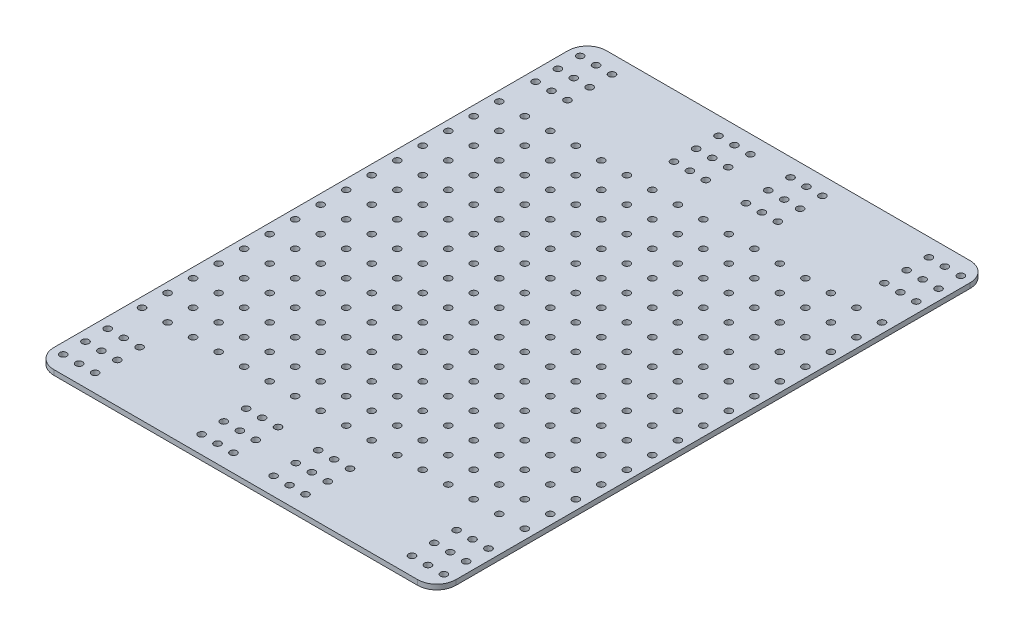
from build123d import *

# Parameters (mm, degrees)
SKETCH2_W            = 200.117666866
SKETCH2_H            = 275
BOSS_EXTRUDE1_DEPTH  = 2.5
M3_CLEARANCE_HOLE1_D = 3.4
MIRROR2_COPY_1_D     = 3.4
FILLET1_R            = 9.525
M3_CLEARANCE_HOLE2_D = 3.4
LPATTERN1_COUNT      = 8
LPATTERN1_PITCH      = 12.7
LPATTERN1_COUNT_DIR2 = 8
LPATTERN1_PITCH_DIR2 = 12.7
MIRROR3_COPY_1_D     = 3.4
MIRROR3_COPY_2_D     = 3.4
MIRROR3_COPY_3_D     = 3.4
MIRROR3_COPY_4_D     = 3.4
MIRROR3_COPY_5_D     = 3.4
MIRROR3_COPY_6_D     = 3.4
MIRROR3_COPY_7_D     = 3.4
MIRROR3_COPY_8_D     = 3.4
MIRROR3_COPY_9_D     = 3.4
MIRROR3_COPY_10_D    = 3.4
MIRROR3_COPY_11_D    = 3.4
MIRROR3_COPY_12_D    = 3.4
MIRROR3_COPY_13_D    = 3.4
MIRROR3_COPY_14_D    = 3.4
MIRROR3_COPY_15_D    = 3.4
MIRROR3_COPY_16_D    = 3.4
MIRROR3_COPY_17_D    = 3.4
MIRROR3_COPY_18_D    = 3.4
MIRROR3_COPY_19_D    = 3.4
MIRROR3_COPY_20_D    = 3.4
MIRROR3_COPY_21_D    = 3.4
MIRROR3_COPY_22_D    = 3.4
MIRROR3_COPY_23_D    = 3.4
MIRROR3_COPY_24_D    = 3.4
MIRROR3_COPY_25_D    = 3.4
MIRROR3_COPY_26_D    = 3.4
MIRROR3_COPY_27_D    = 3.4
MIRROR3_COPY_28_D    = 3.4
MIRROR3_COPY_29_D    = 3.4
MIRROR3_COPY_30_D    = 3.4
MIRROR3_COPY_31_D    = 3.4
MIRROR3_COPY_32_D    = 3.4
MIRROR3_COPY_33_D    = 3.4
MIRROR3_COPY_34_D    = 3.4
MIRROR3_COPY_35_D    = 3.4
MIRROR3_COPY_36_D    = 3.4
MIRROR3_COPY_37_D    = 3.4
MIRROR3_COPY_38_D    = 3.4
MIRROR3_COPY_39_D    = 3.4
MIRROR3_COPY_40_D    = 3.4
MIRROR3_COPY_41_D    = 3.4
MIRROR3_COPY_42_D    = 3.4
MIRROR3_COPY_43_D    = 3.4
MIRROR3_COPY_44_D    = 3.4
MIRROR3_COPY_45_D    = 3.4
MIRROR3_COPY_46_D    = 3.4
MIRROR3_COPY_47_D    = 3.4
MIRROR3_COPY_48_D    = 3.4
MIRROR3_COPY_49_D    = 3.4
MIRROR3_COPY_50_D    = 3.4
MIRROR3_COPY_51_D    = 3.4
MIRROR3_COPY_52_D    = 3.4
MIRROR3_COPY_53_D    = 3.4
MIRROR3_COPY_54_D    = 3.4
MIRROR3_COPY_55_D    = 3.4
MIRROR3_COPY_56_D    = 3.4
MIRROR3_COPY_57_D    = 3.4
MIRROR3_COPY_58_D    = 3.4
MIRROR3_COPY_59_D    = 3.4
MIRROR3_COPY_60_D    = 3.4
MIRROR3_COPY_61_D    = 3.4
MIRROR3_COPY_62_D    = 3.4
MIRROR3_COPY_63_D    = 3.4
MIRROR4_COPY_1_D     = 3.4
MIRROR4_COPY_2_D     = 3.4
MIRROR4_COPY_3_D     = 3.4
MIRROR4_COPY_4_D     = 3.4
MIRROR4_COPY_5_D     = 3.4
MIRROR4_COPY_6_D     = 3.4
MIRROR4_COPY_7_D     = 3.4
MIRROR4_COPY_8_D     = 3.4
MIRROR4_COPY_9_D     = 3.4
MIRROR4_COPY_10_D    = 3.4
MIRROR4_COPY_11_D    = 3.4
MIRROR4_COPY_12_D    = 3.4
MIRROR4_COPY_13_D    = 3.4
MIRROR4_COPY_14_D    = 3.4
MIRROR4_COPY_15_D    = 3.4
MIRROR4_COPY_16_D    = 3.4
MIRROR4_COPY_17_D    = 3.4
MIRROR4_COPY_18_D    = 3.4
MIRROR4_COPY_19_D    = 3.4
MIRROR4_COPY_20_D    = 3.4
MIRROR4_COPY_21_D    = 3.4
MIRROR4_COPY_22_D    = 3.4
MIRROR4_COPY_23_D    = 3.4
MIRROR4_COPY_24_D    = 3.4
MIRROR4_COPY_25_D    = 3.4
MIRROR4_COPY_26_D    = 3.4
MIRROR4_COPY_27_D    = 3.4
MIRROR4_COPY_28_D    = 3.4
MIRROR4_COPY_29_D    = 3.4
MIRROR4_COPY_30_D    = 3.4
MIRROR4_COPY_31_D    = 3.4
MIRROR4_COPY_32_D    = 3.4
MIRROR4_COPY_33_D    = 3.4
MIRROR4_COPY_34_D    = 3.4
MIRROR4_COPY_35_D    = 3.4
MIRROR4_COPY_36_D    = 3.4
MIRROR4_COPY_37_D    = 3.4
MIRROR4_COPY_38_D    = 3.4
MIRROR4_COPY_39_D    = 3.4
MIRROR4_COPY_40_D    = 3.4
MIRROR4_COPY_41_D    = 3.4
MIRROR4_COPY_42_D    = 3.4
MIRROR4_COPY_43_D    = 3.4
MIRROR4_COPY_44_D    = 3.4
MIRROR4_COPY_45_D    = 3.4
MIRROR4_COPY_46_D    = 3.4
MIRROR4_COPY_47_D    = 3.4
MIRROR4_COPY_48_D    = 3.4
MIRROR4_COPY_49_D    = 3.4
MIRROR4_COPY_50_D    = 3.4
MIRROR4_COPY_51_D    = 3.4
MIRROR4_COPY_52_D    = 3.4
MIRROR4_COPY_53_D    = 3.4
MIRROR4_COPY_54_D    = 3.4
MIRROR4_COPY_55_D    = 3.4
MIRROR4_COPY_56_D    = 3.4
MIRROR4_COPY_57_D    = 3.4
MIRROR4_COPY_58_D    = 3.4
MIRROR4_COPY_59_D    = 3.4
MIRROR4_COPY_60_D    = 3.4
MIRROR4_COPY_61_D    = 3.4
MIRROR4_COPY_62_D    = 3.4
MIRROR4_COPY_63_D    = 3.4
MIRROR4_COPY_64_D    = 3.4
MIRROR4_COPY_65_D    = 3.4
MIRROR4_COPY_66_D    = 3.4
MIRROR4_COPY_67_D    = 3.4
MIRROR4_COPY_68_D    = 3.4
MIRROR4_COPY_69_D    = 3.4
MIRROR4_COPY_70_D    = 3.4
MIRROR4_COPY_71_D    = 3.4
MIRROR4_COPY_72_D    = 3.4
MIRROR4_COPY_73_D    = 3.4
MIRROR4_COPY_74_D    = 3.4
MIRROR4_COPY_75_D    = 3.4
MIRROR4_COPY_76_D    = 3.4
MIRROR4_COPY_77_D    = 3.4
MIRROR4_COPY_78_D    = 3.4
MIRROR4_COPY_79_D    = 3.4
MIRROR4_COPY_80_D    = 3.4
MIRROR4_COPY_81_D    = 3.4
MIRROR4_COPY_82_D    = 3.4
MIRROR4_COPY_83_D    = 3.4
MIRROR4_COPY_84_D    = 3.4
MIRROR4_COPY_85_D    = 3.4
MIRROR4_COPY_86_D    = 3.4
MIRROR4_COPY_87_D    = 3.4
MIRROR4_COPY_88_D    = 3.4
MIRROR4_COPY_89_D    = 3.4
MIRROR4_COPY_90_D    = 3.4
MIRROR4_COPY_91_D    = 3.4
MIRROR4_COPY_92_D    = 3.4
MIRROR4_COPY_93_D    = 3.4
MIRROR4_COPY_94_D    = 3.4
MIRROR4_COPY_95_D    = 3.4
MIRROR4_COPY_96_D    = 3.4
MIRROR4_COPY_97_D    = 3.4
MIRROR4_COPY_98_D    = 3.4
MIRROR4_COPY_99_D    = 3.4
MIRROR4_COPY_100_D   = 3.4
MIRROR4_COPY_101_D   = 3.4
MIRROR4_COPY_102_D   = 3.4
MIRROR4_COPY_103_D   = 3.4
MIRROR4_COPY_104_D   = 3.4
MIRROR4_COPY_105_D   = 3.4
MIRROR4_COPY_106_D   = 3.4
MIRROR4_COPY_107_D   = 3.4
MIRROR4_COPY_108_D   = 3.4
MIRROR4_COPY_109_D   = 3.4
MIRROR4_COPY_110_D   = 3.4
MIRROR4_COPY_111_D   = 3.4
MIRROR4_COPY_112_D   = 3.4
MIRROR4_COPY_113_D   = 3.4
MIRROR4_COPY_114_D   = 3.4
MIRROR4_COPY_115_D   = 3.4
MIRROR4_COPY_116_D   = 3.4
MIRROR4_COPY_117_D   = 3.4
MIRROR4_COPY_118_D   = 3.4
MIRROR4_COPY_119_D   = 3.4
MIRROR4_COPY_120_D   = 3.4
MIRROR4_COPY_121_D   = 3.4
MIRROR4_COPY_122_D   = 3.4
MIRROR4_COPY_123_D   = 3.4
MIRROR4_COPY_124_D   = 3.4
MIRROR4_COPY_125_D   = 3.4
MIRROR4_COPY_126_D   = 3.4
MIRROR4_COPY_127_D   = 3.4


with BuildPart() as part:
    # Sketch2 → Boss-Extrude1 (new body)
    with BuildSketch(Plane(origin=(0, 50, 0), x_dir=(1, 0, 0), z_dir=(0, 1, 0))):
        Rectangle(SKETCH2_W, SKETCH2_H)
    extrude(amount=BOSS_EXTRUDE1_DEPTH)

    # M3 Clearance Hole1 (through all)
    with Locations(Plane(origin=(-94.749736615, 52.5, 106.4725), x_dir=(1, 0, 0), z_dir=(0, 1, 0))):
        with Locations((0, 0), (7.9375, 0), (15.875, 0), (15.875, -11.08875), (7.9375, -11.08875), (0, -11.08875), (0, -22.1775), (7.9375, -22.1775), (15.875, -22.1775), (68.893486615, 0), (76.830986615, 0), (84.768486615, 0), (84.768486615, -11.08875), (76.830986615, -11.08875), (68.893486615, -11.08875), (68.893486615, -22.1775), (76.830986615, -22.1775), (84.768486615, -22.1775)):
            m3_clearance_hole1 = Hole(M3_CLEARANCE_HOLE1_D / 2)

    # Mirror1: M3 Clearance Hole1 across plane
    add(m3_clearance_hole1.mirror(Plane(origin=(0, 0, 0), x_dir=(0, 0, 1), z_dir=(1, 0, 0))), mode=Mode.SUBTRACT)

    # Mirror2: M3 Clearance Hole1 across plane
    add(m3_clearance_hole1.mirror(Plane.XY), mode=Mode.SUBTRACT)

    # Mirror2 copy 1 (through all)
    with Locations(Plane(origin=(94.749736615, 52.5, -106.4725), x_dir=(-1, 0, 0), z_dir=(0, 1, 0))):
        with Locations((0, 0), (7.9375, 0), (15.875, 0), (15.875, -11.08875), (7.9375, -11.08875), (0, -11.08875), (0, -22.1775), (7.9375, -22.1775), (15.875, -22.1775), (68.893486615, 0), (76.830986615, 0), (84.768486615, 0), (84.768486615, -11.08875), (76.830986615, -11.08875), (68.893486615, -11.08875), (68.893486615, -22.1775), (76.830986615, -22.1775), (84.768486615, -22.1775)):
            Hole(MIRROR2_COPY_1_D / 2)

    # Fillet1
    fillet1_edges = [part.edges().sort_by_distance(p)[0] for p in [
        (-100.058833433, 51.25, -137.5),
        (100.058833433, 51.25, 137.5),
        (-100.058833433, 51.25, 137.5),
        (100.058833433, 51.25, -137.5),
    ]]
    fillet(fillet1_edges, radius=FILLET1_R)

    # M3 Clearance Hole2 (through all)
    with Locations(Plane(origin=(0, 52.5, 0), x_dir=(1, 0, 0), z_dir=(0, 1, 0))):
        with Locations((6.35, 0)):
            m3_clearance_hole2 = Hole(M3_CLEARANCE_HOLE2_D / 2)

    # LPattern1: M3 Clearance Hole2 8 × 8
    with Locations(*[(j * LPATTERN1_PITCH_DIR2, 0, i * LPATTERN1_PITCH) for i in range(LPATTERN1_COUNT) for j in range(LPATTERN1_COUNT_DIR2) if (i, j) != (0, 0)]):
        add(m3_clearance_hole2, mode=Mode.SUBTRACT)

    # Mirror3: M3 Clearance Hole2 across plane
    add(m3_clearance_hole2.mirror(Plane.XY), mode=Mode.SUBTRACT)

    # Mirror3 copy 1 (through all)
    with Locations(Plane(origin=(12.7, 52.5, 0), x_dir=(1, 0, 0), z_dir=(0, 1, 0))):
        with Locations((6.35, 0)):
            Hole(MIRROR3_COPY_1_D / 2)

    # Mirror3 copy 2 (through all)
    with Locations(Plane(origin=(25.4, 52.5, 0), x_dir=(1, 0, 0), z_dir=(0, 1, 0))):
        with Locations((6.35, 0)):
            Hole(MIRROR3_COPY_2_D / 2)

    # Mirror3 copy 3 (through all)
    with Locations(Plane(origin=(38.1, 52.5, 0), x_dir=(1, 0, 0), z_dir=(0, 1, 0))):
        with Locations((6.35, 0)):
            Hole(MIRROR3_COPY_3_D / 2)

    # Mirror3 copy 4 (through all)
    with Locations(Plane(origin=(50.8, 52.5, 0), x_dir=(1, 0, 0), z_dir=(0, 1, 0))):
        with Locations((6.35, 0)):
            Hole(MIRROR3_COPY_4_D / 2)

    # Mirror3 copy 5 (through all)
    with Locations(Plane(origin=(63.5, 52.5, 0), x_dir=(1, 0, 0), z_dir=(0, 1, 0))):
        with Locations((6.35, 0)):
            Hole(MIRROR3_COPY_5_D / 2)

    # Mirror3 copy 6 (through all)
    with Locations(Plane(origin=(76.2, 52.5, 0), x_dir=(1, 0, 0), z_dir=(0, 1, 0))):
        with Locations((6.35, 0)):
            Hole(MIRROR3_COPY_6_D / 2)

    # Mirror3 copy 7 (through all)
    with Locations(Plane(origin=(88.9, 52.5, 0), x_dir=(1, 0, 0), z_dir=(0, 1, 0))):
        with Locations((6.35, 0)):
            Hole(MIRROR3_COPY_7_D / 2)

    # Mirror3 copy 8 (through all)
    with Locations(Plane(origin=(0, 52.5, -12.7), x_dir=(1, 0, 0), z_dir=(0, 1, 0))):
        with Locations((6.35, 0)):
            Hole(MIRROR3_COPY_8_D / 2)

    # Mirror3 copy 9 (through all)
    with Locations(Plane(origin=(12.7, 52.5, -12.7), x_dir=(1, 0, 0), z_dir=(0, 1, 0))):
        with Locations((6.35, 0)):
            Hole(MIRROR3_COPY_9_D / 2)

    # Mirror3 copy 10 (through all)
    with Locations(Plane(origin=(25.4, 52.5, -12.7), x_dir=(1, 0, 0), z_dir=(0, 1, 0))):
        with Locations((6.35, 0)):
            Hole(MIRROR3_COPY_10_D / 2)

    # Mirror3 copy 11 (through all)
    with Locations(Plane(origin=(38.1, 52.5, -12.7), x_dir=(1, 0, 0), z_dir=(0, 1, 0))):
        with Locations((6.35, 0)):
            Hole(MIRROR3_COPY_11_D / 2)

    # Mirror3 copy 12 (through all)
    with Locations(Plane(origin=(50.8, 52.5, -12.7), x_dir=(1, 0, 0), z_dir=(0, 1, 0))):
        with Locations((6.35, 0)):
            Hole(MIRROR3_COPY_12_D / 2)

    # Mirror3 copy 13 (through all)
    with Locations(Plane(origin=(63.5, 52.5, -12.7), x_dir=(1, 0, 0), z_dir=(0, 1, 0))):
        with Locations((6.35, 0)):
            Hole(MIRROR3_COPY_13_D / 2)

    # Mirror3 copy 14 (through all)
    with Locations(Plane(origin=(76.2, 52.5, -12.7), x_dir=(1, 0, 0), z_dir=(0, 1, 0))):
        with Locations((6.35, 0)):
            Hole(MIRROR3_COPY_14_D / 2)

    # Mirror3 copy 15 (through all)
    with Locations(Plane(origin=(88.9, 52.5, -12.7), x_dir=(1, 0, 0), z_dir=(0, 1, 0))):
        with Locations((6.35, 0)):
            Hole(MIRROR3_COPY_15_D / 2)

    # Mirror3 copy 16 (through all)
    with Locations(Plane(origin=(0, 52.5, -25.4), x_dir=(1, 0, 0), z_dir=(0, 1, 0))):
        with Locations((6.35, 0)):
            Hole(MIRROR3_COPY_16_D / 2)

    # Mirror3 copy 17 (through all)
    with Locations(Plane(origin=(12.7, 52.5, -25.4), x_dir=(1, 0, 0), z_dir=(0, 1, 0))):
        with Locations((6.35, 0)):
            Hole(MIRROR3_COPY_17_D / 2)

    # Mirror3 copy 18 (through all)
    with Locations(Plane(origin=(25.4, 52.5, -25.4), x_dir=(1, 0, 0), z_dir=(0, 1, 0))):
        with Locations((6.35, 0)):
            Hole(MIRROR3_COPY_18_D / 2)

    # Mirror3 copy 19 (through all)
    with Locations(Plane(origin=(38.1, 52.5, -25.4), x_dir=(1, 0, 0), z_dir=(0, 1, 0))):
        with Locations((6.35, 0)):
            Hole(MIRROR3_COPY_19_D / 2)

    # Mirror3 copy 20 (through all)
    with Locations(Plane(origin=(50.8, 52.5, -25.4), x_dir=(1, 0, 0), z_dir=(0, 1, 0))):
        with Locations((6.35, 0)):
            Hole(MIRROR3_COPY_20_D / 2)

    # Mirror3 copy 21 (through all)
    with Locations(Plane(origin=(63.5, 52.5, -25.4), x_dir=(1, 0, 0), z_dir=(0, 1, 0))):
        with Locations((6.35, 0)):
            Hole(MIRROR3_COPY_21_D / 2)

    # Mirror3 copy 22 (through all)
    with Locations(Plane(origin=(76.2, 52.5, -25.4), x_dir=(1, 0, 0), z_dir=(0, 1, 0))):
        with Locations((6.35, 0)):
            Hole(MIRROR3_COPY_22_D / 2)

    # Mirror3 copy 23 (through all)
    with Locations(Plane(origin=(88.9, 52.5, -25.4), x_dir=(1, 0, 0), z_dir=(0, 1, 0))):
        with Locations((6.35, 0)):
            Hole(MIRROR3_COPY_23_D / 2)

    # Mirror3 copy 24 (through all)
    with Locations(Plane(origin=(0, 52.5, -38.1), x_dir=(1, 0, 0), z_dir=(0, 1, 0))):
        with Locations((6.35, 0)):
            Hole(MIRROR3_COPY_24_D / 2)

    # Mirror3 copy 25 (through all)
    with Locations(Plane(origin=(12.7, 52.5, -38.1), x_dir=(1, 0, 0), z_dir=(0, 1, 0))):
        with Locations((6.35, 0)):
            Hole(MIRROR3_COPY_25_D / 2)

    # Mirror3 copy 26 (through all)
    with Locations(Plane(origin=(25.4, 52.5, -38.1), x_dir=(1, 0, 0), z_dir=(0, 1, 0))):
        with Locations((6.35, 0)):
            Hole(MIRROR3_COPY_26_D / 2)

    # Mirror3 copy 27 (through all)
    with Locations(Plane(origin=(38.1, 52.5, -38.1), x_dir=(1, 0, 0), z_dir=(0, 1, 0))):
        with Locations((6.35, 0)):
            Hole(MIRROR3_COPY_27_D / 2)

    # Mirror3 copy 28 (through all)
    with Locations(Plane(origin=(50.8, 52.5, -38.1), x_dir=(1, 0, 0), z_dir=(0, 1, 0))):
        with Locations((6.35, 0)):
            Hole(MIRROR3_COPY_28_D / 2)

    # Mirror3 copy 29 (through all)
    with Locations(Plane(origin=(63.5, 52.5, -38.1), x_dir=(1, 0, 0), z_dir=(0, 1, 0))):
        with Locations((6.35, 0)):
            Hole(MIRROR3_COPY_29_D / 2)

    # Mirror3 copy 30 (through all)
    with Locations(Plane(origin=(76.2, 52.5, -38.1), x_dir=(1, 0, 0), z_dir=(0, 1, 0))):
        with Locations((6.35, 0)):
            Hole(MIRROR3_COPY_30_D / 2)

    # Mirror3 copy 31 (through all)
    with Locations(Plane(origin=(88.9, 52.5, -38.1), x_dir=(1, 0, 0), z_dir=(0, 1, 0))):
        with Locations((6.35, 0)):
            Hole(MIRROR3_COPY_31_D / 2)

    # Mirror3 copy 32 (through all)
    with Locations(Plane(origin=(0, 52.5, -50.8), x_dir=(1, 0, 0), z_dir=(0, 1, 0))):
        with Locations((6.35, 0)):
            Hole(MIRROR3_COPY_32_D / 2)

    # Mirror3 copy 33 (through all)
    with Locations(Plane(origin=(12.7, 52.5, -50.8), x_dir=(1, 0, 0), z_dir=(0, 1, 0))):
        with Locations((6.35, 0)):
            Hole(MIRROR3_COPY_33_D / 2)

    # Mirror3 copy 34 (through all)
    with Locations(Plane(origin=(25.4, 52.5, -50.8), x_dir=(1, 0, 0), z_dir=(0, 1, 0))):
        with Locations((6.35, 0)):
            Hole(MIRROR3_COPY_34_D / 2)

    # Mirror3 copy 35 (through all)
    with Locations(Plane(origin=(38.1, 52.5, -50.8), x_dir=(1, 0, 0), z_dir=(0, 1, 0))):
        with Locations((6.35, 0)):
            Hole(MIRROR3_COPY_35_D / 2)

    # Mirror3 copy 36 (through all)
    with Locations(Plane(origin=(50.8, 52.5, -50.8), x_dir=(1, 0, 0), z_dir=(0, 1, 0))):
        with Locations((6.35, 0)):
            Hole(MIRROR3_COPY_36_D / 2)

    # Mirror3 copy 37 (through all)
    with Locations(Plane(origin=(63.5, 52.5, -50.8), x_dir=(1, 0, 0), z_dir=(0, 1, 0))):
        with Locations((6.35, 0)):
            Hole(MIRROR3_COPY_37_D / 2)

    # Mirror3 copy 38 (through all)
    with Locations(Plane(origin=(76.2, 52.5, -50.8), x_dir=(1, 0, 0), z_dir=(0, 1, 0))):
        with Locations((6.35, 0)):
            Hole(MIRROR3_COPY_38_D / 2)

    # Mirror3 copy 39 (through all)
    with Locations(Plane(origin=(88.9, 52.5, -50.8), x_dir=(1, 0, 0), z_dir=(0, 1, 0))):
        with Locations((6.35, 0)):
            Hole(MIRROR3_COPY_39_D / 2)

    # Mirror3 copy 40 (through all)
    with Locations(Plane(origin=(0, 52.5, -63.5), x_dir=(1, 0, 0), z_dir=(0, 1, 0))):
        with Locations((6.35, 0)):
            Hole(MIRROR3_COPY_40_D / 2)

    # Mirror3 copy 41 (through all)
    with Locations(Plane(origin=(12.7, 52.5, -63.5), x_dir=(1, 0, 0), z_dir=(0, 1, 0))):
        with Locations((6.35, 0)):
            Hole(MIRROR3_COPY_41_D / 2)

    # Mirror3 copy 42 (through all)
    with Locations(Plane(origin=(25.4, 52.5, -63.5), x_dir=(1, 0, 0), z_dir=(0, 1, 0))):
        with Locations((6.35, 0)):
            Hole(MIRROR3_COPY_42_D / 2)

    # Mirror3 copy 43 (through all)
    with Locations(Plane(origin=(38.1, 52.5, -63.5), x_dir=(1, 0, 0), z_dir=(0, 1, 0))):
        with Locations((6.35, 0)):
            Hole(MIRROR3_COPY_43_D / 2)

    # Mirror3 copy 44 (through all)
    with Locations(Plane(origin=(50.8, 52.5, -63.5), x_dir=(1, 0, 0), z_dir=(0, 1, 0))):
        with Locations((6.35, 0)):
            Hole(MIRROR3_COPY_44_D / 2)

    # Mirror3 copy 45 (through all)
    with Locations(Plane(origin=(63.5, 52.5, -63.5), x_dir=(1, 0, 0), z_dir=(0, 1, 0))):
        with Locations((6.35, 0)):
            Hole(MIRROR3_COPY_45_D / 2)

    # Mirror3 copy 46 (through all)
    with Locations(Plane(origin=(76.2, 52.5, -63.5), x_dir=(1, 0, 0), z_dir=(0, 1, 0))):
        with Locations((6.35, 0)):
            Hole(MIRROR3_COPY_46_D / 2)

    # Mirror3 copy 47 (through all)
    with Locations(Plane(origin=(88.9, 52.5, -63.5), x_dir=(1, 0, 0), z_dir=(0, 1, 0))):
        with Locations((6.35, 0)):
            Hole(MIRROR3_COPY_47_D / 2)

    # Mirror3 copy 48 (through all)
    with Locations(Plane(origin=(0, 52.5, -76.2), x_dir=(1, 0, 0), z_dir=(0, 1, 0))):
        with Locations((6.35, 0)):
            Hole(MIRROR3_COPY_48_D / 2)

    # Mirror3 copy 49 (through all)
    with Locations(Plane(origin=(12.7, 52.5, -76.2), x_dir=(1, 0, 0), z_dir=(0, 1, 0))):
        with Locations((6.35, 0)):
            Hole(MIRROR3_COPY_49_D / 2)

    # Mirror3 copy 50 (through all)
    with Locations(Plane(origin=(25.4, 52.5, -76.2), x_dir=(1, 0, 0), z_dir=(0, 1, 0))):
        with Locations((6.35, 0)):
            Hole(MIRROR3_COPY_50_D / 2)

    # Mirror3 copy 51 (through all)
    with Locations(Plane(origin=(38.1, 52.5, -76.2), x_dir=(1, 0, 0), z_dir=(0, 1, 0))):
        with Locations((6.35, 0)):
            Hole(MIRROR3_COPY_51_D / 2)

    # Mirror3 copy 52 (through all)
    with Locations(Plane(origin=(50.8, 52.5, -76.2), x_dir=(1, 0, 0), z_dir=(0, 1, 0))):
        with Locations((6.35, 0)):
            Hole(MIRROR3_COPY_52_D / 2)

    # Mirror3 copy 53 (through all)
    with Locations(Plane(origin=(63.5, 52.5, -76.2), x_dir=(1, 0, 0), z_dir=(0, 1, 0))):
        with Locations((6.35, 0)):
            Hole(MIRROR3_COPY_53_D / 2)

    # Mirror3 copy 54 (through all)
    with Locations(Plane(origin=(76.2, 52.5, -76.2), x_dir=(1, 0, 0), z_dir=(0, 1, 0))):
        with Locations((6.35, 0)):
            Hole(MIRROR3_COPY_54_D / 2)

    # Mirror3 copy 55 (through all)
    with Locations(Plane(origin=(88.9, 52.5, -76.2), x_dir=(1, 0, 0), z_dir=(0, 1, 0))):
        with Locations((6.35, 0)):
            Hole(MIRROR3_COPY_55_D / 2)

    # Mirror3 copy 56 (through all)
    with Locations(Plane(origin=(0, 52.5, -88.9), x_dir=(1, 0, 0), z_dir=(0, 1, 0))):
        with Locations((6.35, 0)):
            Hole(MIRROR3_COPY_56_D / 2)

    # Mirror3 copy 57 (through all)
    with Locations(Plane(origin=(12.7, 52.5, -88.9), x_dir=(1, 0, 0), z_dir=(0, 1, 0))):
        with Locations((6.35, 0)):
            Hole(MIRROR3_COPY_57_D / 2)

    # Mirror3 copy 58 (through all)
    with Locations(Plane(origin=(25.4, 52.5, -88.9), x_dir=(1, 0, 0), z_dir=(0, 1, 0))):
        with Locations((6.35, 0)):
            Hole(MIRROR3_COPY_58_D / 2)

    # Mirror3 copy 59 (through all)
    with Locations(Plane(origin=(38.1, 52.5, -88.9), x_dir=(1, 0, 0), z_dir=(0, 1, 0))):
        with Locations((6.35, 0)):
            Hole(MIRROR3_COPY_59_D / 2)

    # Mirror3 copy 60 (through all)
    with Locations(Plane(origin=(50.8, 52.5, -88.9), x_dir=(1, 0, 0), z_dir=(0, 1, 0))):
        with Locations((6.35, 0)):
            Hole(MIRROR3_COPY_60_D / 2)

    # Mirror3 copy 61 (through all)
    with Locations(Plane(origin=(63.5, 52.5, -88.9), x_dir=(1, 0, 0), z_dir=(0, 1, 0))):
        with Locations((6.35, 0)):
            Hole(MIRROR3_COPY_61_D / 2)

    # Mirror3 copy 62 (through all)
    with Locations(Plane(origin=(76.2, 52.5, -88.9), x_dir=(1, 0, 0), z_dir=(0, 1, 0))):
        with Locations((6.35, 0)):
            Hole(MIRROR3_COPY_62_D / 2)

    # Mirror3 copy 63 (through all)
    with Locations(Plane(origin=(88.9, 52.5, -88.9), x_dir=(1, 0, 0), z_dir=(0, 1, 0))):
        with Locations((6.35, 0)):
            Hole(MIRROR3_COPY_63_D / 2)

    # Mirror4: M3 Clearance Hole2 across plane
    add(m3_clearance_hole2.mirror(Plane(origin=(0, 0, 0), x_dir=(0, 0, 1), z_dir=(1, 0, 0))), mode=Mode.SUBTRACT)

    # Mirror4 copy 1 (through all)
    with Locations(Plane(origin=(-12.7, 52.5, 0), x_dir=(-1, 0, 0), z_dir=(0, 1, 0))):
        with Locations((6.35, 0)):
            Hole(MIRROR4_COPY_1_D / 2)

    # Mirror4 copy 2 (through all)
    with Locations(Plane(origin=(-25.4, 52.5, 0), x_dir=(-1, 0, 0), z_dir=(0, 1, 0))):
        with Locations((6.35, 0)):
            Hole(MIRROR4_COPY_2_D / 2)

    # Mirror4 copy 3 (through all)
    with Locations(Plane(origin=(-38.1, 52.5, 0), x_dir=(-1, 0, 0), z_dir=(0, 1, 0))):
        with Locations((6.35, 0)):
            Hole(MIRROR4_COPY_3_D / 2)

    # Mirror4 copy 4 (through all)
    with Locations(Plane(origin=(-50.8, 52.5, 0), x_dir=(-1, 0, 0), z_dir=(0, 1, 0))):
        with Locations((6.35, 0)):
            Hole(MIRROR4_COPY_4_D / 2)

    # Mirror4 copy 5 (through all)
    with Locations(Plane(origin=(-63.5, 52.5, 0), x_dir=(-1, 0, 0), z_dir=(0, 1, 0))):
        with Locations((6.35, 0)):
            Hole(MIRROR4_COPY_5_D / 2)

    # Mirror4 copy 6 (through all)
    with Locations(Plane(origin=(-76.2, 52.5, 0), x_dir=(-1, 0, 0), z_dir=(0, 1, 0))):
        with Locations((6.35, 0)):
            Hole(MIRROR4_COPY_6_D / 2)

    # Mirror4 copy 7 (through all)
    with Locations(Plane(origin=(-88.9, 52.5, 0), x_dir=(-1, 0, 0), z_dir=(0, 1, 0))):
        with Locations((6.35, 0)):
            Hole(MIRROR4_COPY_7_D / 2)

    # Mirror4 copy 8 (through all)
    with Locations(Plane(origin=(0, 52.5, 12.7), x_dir=(-1, 0, 0), z_dir=(0, 1, 0))):
        with Locations((6.35, 0)):
            Hole(MIRROR4_COPY_8_D / 2)

    # Mirror4 copy 9 (through all)
    with Locations(Plane(origin=(-12.7, 52.5, 12.7), x_dir=(-1, 0, 0), z_dir=(0, 1, 0))):
        with Locations((6.35, 0)):
            Hole(MIRROR4_COPY_9_D / 2)

    # Mirror4 copy 10 (through all)
    with Locations(Plane(origin=(-25.4, 52.5, 12.7), x_dir=(-1, 0, 0), z_dir=(0, 1, 0))):
        with Locations((6.35, 0)):
            Hole(MIRROR4_COPY_10_D / 2)

    # Mirror4 copy 11 (through all)
    with Locations(Plane(origin=(-38.1, 52.5, 12.7), x_dir=(-1, 0, 0), z_dir=(0, 1, 0))):
        with Locations((6.35, 0)):
            Hole(MIRROR4_COPY_11_D / 2)

    # Mirror4 copy 12 (through all)
    with Locations(Plane(origin=(-50.8, 52.5, 12.7), x_dir=(-1, 0, 0), z_dir=(0, 1, 0))):
        with Locations((6.35, 0)):
            Hole(MIRROR4_COPY_12_D / 2)

    # Mirror4 copy 13 (through all)
    with Locations(Plane(origin=(-63.5, 52.5, 12.7), x_dir=(-1, 0, 0), z_dir=(0, 1, 0))):
        with Locations((6.35, 0)):
            Hole(MIRROR4_COPY_13_D / 2)

    # Mirror4 copy 14 (through all)
    with Locations(Plane(origin=(-76.2, 52.5, 12.7), x_dir=(-1, 0, 0), z_dir=(0, 1, 0))):
        with Locations((6.35, 0)):
            Hole(MIRROR4_COPY_14_D / 2)

    # Mirror4 copy 15 (through all)
    with Locations(Plane(origin=(-88.9, 52.5, 12.7), x_dir=(-1, 0, 0), z_dir=(0, 1, 0))):
        with Locations((6.35, 0)):
            Hole(MIRROR4_COPY_15_D / 2)

    # Mirror4 copy 16 (through all)
    with Locations(Plane(origin=(0, 52.5, 25.4), x_dir=(-1, 0, 0), z_dir=(0, 1, 0))):
        with Locations((6.35, 0)):
            Hole(MIRROR4_COPY_16_D / 2)

    # Mirror4 copy 17 (through all)
    with Locations(Plane(origin=(-12.7, 52.5, 25.4), x_dir=(-1, 0, 0), z_dir=(0, 1, 0))):
        with Locations((6.35, 0)):
            Hole(MIRROR4_COPY_17_D / 2)

    # Mirror4 copy 18 (through all)
    with Locations(Plane(origin=(-25.4, 52.5, 25.4), x_dir=(-1, 0, 0), z_dir=(0, 1, 0))):
        with Locations((6.35, 0)):
            Hole(MIRROR4_COPY_18_D / 2)

    # Mirror4 copy 19 (through all)
    with Locations(Plane(origin=(-38.1, 52.5, 25.4), x_dir=(-1, 0, 0), z_dir=(0, 1, 0))):
        with Locations((6.35, 0)):
            Hole(MIRROR4_COPY_19_D / 2)

    # Mirror4 copy 20 (through all)
    with Locations(Plane(origin=(-50.8, 52.5, 25.4), x_dir=(-1, 0, 0), z_dir=(0, 1, 0))):
        with Locations((6.35, 0)):
            Hole(MIRROR4_COPY_20_D / 2)

    # Mirror4 copy 21 (through all)
    with Locations(Plane(origin=(-63.5, 52.5, 25.4), x_dir=(-1, 0, 0), z_dir=(0, 1, 0))):
        with Locations((6.35, 0)):
            Hole(MIRROR4_COPY_21_D / 2)

    # Mirror4 copy 22 (through all)
    with Locations(Plane(origin=(-76.2, 52.5, 25.4), x_dir=(-1, 0, 0), z_dir=(0, 1, 0))):
        with Locations((6.35, 0)):
            Hole(MIRROR4_COPY_22_D / 2)

    # Mirror4 copy 23 (through all)
    with Locations(Plane(origin=(-88.9, 52.5, 25.4), x_dir=(-1, 0, 0), z_dir=(0, 1, 0))):
        with Locations((6.35, 0)):
            Hole(MIRROR4_COPY_23_D / 2)

    # Mirror4 copy 24 (through all)
    with Locations(Plane(origin=(0, 52.5, 38.1), x_dir=(-1, 0, 0), z_dir=(0, 1, 0))):
        with Locations((6.35, 0)):
            Hole(MIRROR4_COPY_24_D / 2)

    # Mirror4 copy 25 (through all)
    with Locations(Plane(origin=(-12.7, 52.5, 38.1), x_dir=(-1, 0, 0), z_dir=(0, 1, 0))):
        with Locations((6.35, 0)):
            Hole(MIRROR4_COPY_25_D / 2)

    # Mirror4 copy 26 (through all)
    with Locations(Plane(origin=(-25.4, 52.5, 38.1), x_dir=(-1, 0, 0), z_dir=(0, 1, 0))):
        with Locations((6.35, 0)):
            Hole(MIRROR4_COPY_26_D / 2)

    # Mirror4 copy 27 (through all)
    with Locations(Plane(origin=(-38.1, 52.5, 38.1), x_dir=(-1, 0, 0), z_dir=(0, 1, 0))):
        with Locations((6.35, 0)):
            Hole(MIRROR4_COPY_27_D / 2)

    # Mirror4 copy 28 (through all)
    with Locations(Plane(origin=(-50.8, 52.5, 38.1), x_dir=(-1, 0, 0), z_dir=(0, 1, 0))):
        with Locations((6.35, 0)):
            Hole(MIRROR4_COPY_28_D / 2)

    # Mirror4 copy 29 (through all)
    with Locations(Plane(origin=(-63.5, 52.5, 38.1), x_dir=(-1, 0, 0), z_dir=(0, 1, 0))):
        with Locations((6.35, 0)):
            Hole(MIRROR4_COPY_29_D / 2)

    # Mirror4 copy 30 (through all)
    with Locations(Plane(origin=(-76.2, 52.5, 38.1), x_dir=(-1, 0, 0), z_dir=(0, 1, 0))):
        with Locations((6.35, 0)):
            Hole(MIRROR4_COPY_30_D / 2)

    # Mirror4 copy 31 (through all)
    with Locations(Plane(origin=(-88.9, 52.5, 38.1), x_dir=(-1, 0, 0), z_dir=(0, 1, 0))):
        with Locations((6.35, 0)):
            Hole(MIRROR4_COPY_31_D / 2)

    # Mirror4 copy 32 (through all)
    with Locations(Plane(origin=(0, 52.5, 50.8), x_dir=(-1, 0, 0), z_dir=(0, 1, 0))):
        with Locations((6.35, 0)):
            Hole(MIRROR4_COPY_32_D / 2)

    # Mirror4 copy 33 (through all)
    with Locations(Plane(origin=(-12.7, 52.5, 50.8), x_dir=(-1, 0, 0), z_dir=(0, 1, 0))):
        with Locations((6.35, 0)):
            Hole(MIRROR4_COPY_33_D / 2)

    # Mirror4 copy 34 (through all)
    with Locations(Plane(origin=(-25.4, 52.5, 50.8), x_dir=(-1, 0, 0), z_dir=(0, 1, 0))):
        with Locations((6.35, 0)):
            Hole(MIRROR4_COPY_34_D / 2)

    # Mirror4 copy 35 (through all)
    with Locations(Plane(origin=(-38.1, 52.5, 50.8), x_dir=(-1, 0, 0), z_dir=(0, 1, 0))):
        with Locations((6.35, 0)):
            Hole(MIRROR4_COPY_35_D / 2)

    # Mirror4 copy 36 (through all)
    with Locations(Plane(origin=(-50.8, 52.5, 50.8), x_dir=(-1, 0, 0), z_dir=(0, 1, 0))):
        with Locations((6.35, 0)):
            Hole(MIRROR4_COPY_36_D / 2)

    # Mirror4 copy 37 (through all)
    with Locations(Plane(origin=(-63.5, 52.5, 50.8), x_dir=(-1, 0, 0), z_dir=(0, 1, 0))):
        with Locations((6.35, 0)):
            Hole(MIRROR4_COPY_37_D / 2)

    # Mirror4 copy 38 (through all)
    with Locations(Plane(origin=(-76.2, 52.5, 50.8), x_dir=(-1, 0, 0), z_dir=(0, 1, 0))):
        with Locations((6.35, 0)):
            Hole(MIRROR4_COPY_38_D / 2)

    # Mirror4 copy 39 (through all)
    with Locations(Plane(origin=(-88.9, 52.5, 50.8), x_dir=(-1, 0, 0), z_dir=(0, 1, 0))):
        with Locations((6.35, 0)):
            Hole(MIRROR4_COPY_39_D / 2)

    # Mirror4 copy 40 (through all)
    with Locations(Plane(origin=(0, 52.5, 63.5), x_dir=(-1, 0, 0), z_dir=(0, 1, 0))):
        with Locations((6.35, 0)):
            Hole(MIRROR4_COPY_40_D / 2)

    # Mirror4 copy 41 (through all)
    with Locations(Plane(origin=(-12.7, 52.5, 63.5), x_dir=(-1, 0, 0), z_dir=(0, 1, 0))):
        with Locations((6.35, 0)):
            Hole(MIRROR4_COPY_41_D / 2)

    # Mirror4 copy 42 (through all)
    with Locations(Plane(origin=(-25.4, 52.5, 63.5), x_dir=(-1, 0, 0), z_dir=(0, 1, 0))):
        with Locations((6.35, 0)):
            Hole(MIRROR4_COPY_42_D / 2)

    # Mirror4 copy 43 (through all)
    with Locations(Plane(origin=(-38.1, 52.5, 63.5), x_dir=(-1, 0, 0), z_dir=(0, 1, 0))):
        with Locations((6.35, 0)):
            Hole(MIRROR4_COPY_43_D / 2)

    # Mirror4 copy 44 (through all)
    with Locations(Plane(origin=(-50.8, 52.5, 63.5), x_dir=(-1, 0, 0), z_dir=(0, 1, 0))):
        with Locations((6.35, 0)):
            Hole(MIRROR4_COPY_44_D / 2)

    # Mirror4 copy 45 (through all)
    with Locations(Plane(origin=(-63.5, 52.5, 63.5), x_dir=(-1, 0, 0), z_dir=(0, 1, 0))):
        with Locations((6.35, 0)):
            Hole(MIRROR4_COPY_45_D / 2)

    # Mirror4 copy 46 (through all)
    with Locations(Plane(origin=(-76.2, 52.5, 63.5), x_dir=(-1, 0, 0), z_dir=(0, 1, 0))):
        with Locations((6.35, 0)):
            Hole(MIRROR4_COPY_46_D / 2)

    # Mirror4 copy 47 (through all)
    with Locations(Plane(origin=(-88.9, 52.5, 63.5), x_dir=(-1, 0, 0), z_dir=(0, 1, 0))):
        with Locations((6.35, 0)):
            Hole(MIRROR4_COPY_47_D / 2)

    # Mirror4 copy 48 (through all)
    with Locations(Plane(origin=(0, 52.5, 76.2), x_dir=(-1, 0, 0), z_dir=(0, 1, 0))):
        with Locations((6.35, 0)):
            Hole(MIRROR4_COPY_48_D / 2)

    # Mirror4 copy 49 (through all)
    with Locations(Plane(origin=(-12.7, 52.5, 76.2), x_dir=(-1, 0, 0), z_dir=(0, 1, 0))):
        with Locations((6.35, 0)):
            Hole(MIRROR4_COPY_49_D / 2)

    # Mirror4 copy 50 (through all)
    with Locations(Plane(origin=(-25.4, 52.5, 76.2), x_dir=(-1, 0, 0), z_dir=(0, 1, 0))):
        with Locations((6.35, 0)):
            Hole(MIRROR4_COPY_50_D / 2)

    # Mirror4 copy 51 (through all)
    with Locations(Plane(origin=(-38.1, 52.5, 76.2), x_dir=(-1, 0, 0), z_dir=(0, 1, 0))):
        with Locations((6.35, 0)):
            Hole(MIRROR4_COPY_51_D / 2)

    # Mirror4 copy 52 (through all)
    with Locations(Plane(origin=(-50.8, 52.5, 76.2), x_dir=(-1, 0, 0), z_dir=(0, 1, 0))):
        with Locations((6.35, 0)):
            Hole(MIRROR4_COPY_52_D / 2)

    # Mirror4 copy 53 (through all)
    with Locations(Plane(origin=(-63.5, 52.5, 76.2), x_dir=(-1, 0, 0), z_dir=(0, 1, 0))):
        with Locations((6.35, 0)):
            Hole(MIRROR4_COPY_53_D / 2)

    # Mirror4 copy 54 (through all)
    with Locations(Plane(origin=(-76.2, 52.5, 76.2), x_dir=(-1, 0, 0), z_dir=(0, 1, 0))):
        with Locations((6.35, 0)):
            Hole(MIRROR4_COPY_54_D / 2)

    # Mirror4 copy 55 (through all)
    with Locations(Plane(origin=(-88.9, 52.5, 76.2), x_dir=(-1, 0, 0), z_dir=(0, 1, 0))):
        with Locations((6.35, 0)):
            Hole(MIRROR4_COPY_55_D / 2)

    # Mirror4 copy 56 (through all)
    with Locations(Plane(origin=(0, 52.5, 88.9), x_dir=(-1, 0, 0), z_dir=(0, 1, 0))):
        with Locations((6.35, 0)):
            Hole(MIRROR4_COPY_56_D / 2)

    # Mirror4 copy 57 (through all)
    with Locations(Plane(origin=(-12.7, 52.5, 88.9), x_dir=(-1, 0, 0), z_dir=(0, 1, 0))):
        with Locations((6.35, 0)):
            Hole(MIRROR4_COPY_57_D / 2)

    # Mirror4 copy 58 (through all)
    with Locations(Plane(origin=(-25.4, 52.5, 88.9), x_dir=(-1, 0, 0), z_dir=(0, 1, 0))):
        with Locations((6.35, 0)):
            Hole(MIRROR4_COPY_58_D / 2)

    # Mirror4 copy 59 (through all)
    with Locations(Plane(origin=(-38.1, 52.5, 88.9), x_dir=(-1, 0, 0), z_dir=(0, 1, 0))):
        with Locations((6.35, 0)):
            Hole(MIRROR4_COPY_59_D / 2)

    # Mirror4 copy 60 (through all)
    with Locations(Plane(origin=(-50.8, 52.5, 88.9), x_dir=(-1, 0, 0), z_dir=(0, 1, 0))):
        with Locations((6.35, 0)):
            Hole(MIRROR4_COPY_60_D / 2)

    # Mirror4 copy 61 (through all)
    with Locations(Plane(origin=(-63.5, 52.5, 88.9), x_dir=(-1, 0, 0), z_dir=(0, 1, 0))):
        with Locations((6.35, 0)):
            Hole(MIRROR4_COPY_61_D / 2)

    # Mirror4 copy 62 (through all)
    with Locations(Plane(origin=(-76.2, 52.5, 88.9), x_dir=(-1, 0, 0), z_dir=(0, 1, 0))):
        with Locations((6.35, 0)):
            Hole(MIRROR4_COPY_62_D / 2)

    # Mirror4 copy 63 (through all)
    with Locations(Plane(origin=(-88.9, 52.5, 88.9), x_dir=(-1, 0, 0), z_dir=(0, 1, 0))):
        with Locations((6.35, 0)):
            Hole(MIRROR4_COPY_63_D / 2)

    # Mirror4 copy 64 (through all)
    with Locations(Plane(origin=(0, 52.5, 0), x_dir=(-1, 0, 0), z_dir=(0, 1, 0))):
        with Locations((6.35, 0)):
            Hole(MIRROR4_COPY_64_D / 2)

    # Mirror4 copy 65 (through all)
    with Locations(Plane(origin=(-12.7, 52.5, 0), x_dir=(-1, 0, 0), z_dir=(0, 1, 0))):
        with Locations((6.35, 0)):
            Hole(MIRROR4_COPY_65_D / 2)

    # Mirror4 copy 66 (through all)
    with Locations(Plane(origin=(-25.4, 52.5, 0), x_dir=(-1, 0, 0), z_dir=(0, 1, 0))):
        with Locations((6.35, 0)):
            Hole(MIRROR4_COPY_66_D / 2)

    # Mirror4 copy 67 (through all)
    with Locations(Plane(origin=(-38.1, 52.5, 0), x_dir=(-1, 0, 0), z_dir=(0, 1, 0))):
        with Locations((6.35, 0)):
            Hole(MIRROR4_COPY_67_D / 2)

    # Mirror4 copy 68 (through all)
    with Locations(Plane(origin=(-50.8, 52.5, 0), x_dir=(-1, 0, 0), z_dir=(0, 1, 0))):
        with Locations((6.35, 0)):
            Hole(MIRROR4_COPY_68_D / 2)

    # Mirror4 copy 69 (through all)
    with Locations(Plane(origin=(-63.5, 52.5, 0), x_dir=(-1, 0, 0), z_dir=(0, 1, 0))):
        with Locations((6.35, 0)):
            Hole(MIRROR4_COPY_69_D / 2)

    # Mirror4 copy 70 (through all)
    with Locations(Plane(origin=(-76.2, 52.5, 0), x_dir=(-1, 0, 0), z_dir=(0, 1, 0))):
        with Locations((6.35, 0)):
            Hole(MIRROR4_COPY_70_D / 2)

    # Mirror4 copy 71 (through all)
    with Locations(Plane(origin=(-88.9, 52.5, 0), x_dir=(-1, 0, 0), z_dir=(0, 1, 0))):
        with Locations((6.35, 0)):
            Hole(MIRROR4_COPY_71_D / 2)

    # Mirror4 copy 72 (through all)
    with Locations(Plane(origin=(0, 52.5, -12.7), x_dir=(-1, 0, 0), z_dir=(0, 1, 0))):
        with Locations((6.35, 0)):
            Hole(MIRROR4_COPY_72_D / 2)

    # Mirror4 copy 73 (through all)
    with Locations(Plane(origin=(-12.7, 52.5, -12.7), x_dir=(-1, 0, 0), z_dir=(0, 1, 0))):
        with Locations((6.35, 0)):
            Hole(MIRROR4_COPY_73_D / 2)

    # Mirror4 copy 74 (through all)
    with Locations(Plane(origin=(-25.4, 52.5, -12.7), x_dir=(-1, 0, 0), z_dir=(0, 1, 0))):
        with Locations((6.35, 0)):
            Hole(MIRROR4_COPY_74_D / 2)

    # Mirror4 copy 75 (through all)
    with Locations(Plane(origin=(-38.1, 52.5, -12.7), x_dir=(-1, 0, 0), z_dir=(0, 1, 0))):
        with Locations((6.35, 0)):
            Hole(MIRROR4_COPY_75_D / 2)

    # Mirror4 copy 76 (through all)
    with Locations(Plane(origin=(-50.8, 52.5, -12.7), x_dir=(-1, 0, 0), z_dir=(0, 1, 0))):
        with Locations((6.35, 0)):
            Hole(MIRROR4_COPY_76_D / 2)

    # Mirror4 copy 77 (through all)
    with Locations(Plane(origin=(-63.5, 52.5, -12.7), x_dir=(-1, 0, 0), z_dir=(0, 1, 0))):
        with Locations((6.35, 0)):
            Hole(MIRROR4_COPY_77_D / 2)

    # Mirror4 copy 78 (through all)
    with Locations(Plane(origin=(-76.2, 52.5, -12.7), x_dir=(-1, 0, 0), z_dir=(0, 1, 0))):
        with Locations((6.35, 0)):
            Hole(MIRROR4_COPY_78_D / 2)

    # Mirror4 copy 79 (through all)
    with Locations(Plane(origin=(-88.9, 52.5, -12.7), x_dir=(-1, 0, 0), z_dir=(0, 1, 0))):
        with Locations((6.35, 0)):
            Hole(MIRROR4_COPY_79_D / 2)

    # Mirror4 copy 80 (through all)
    with Locations(Plane(origin=(0, 52.5, -25.4), x_dir=(-1, 0, 0), z_dir=(0, 1, 0))):
        with Locations((6.35, 0)):
            Hole(MIRROR4_COPY_80_D / 2)

    # Mirror4 copy 81 (through all)
    with Locations(Plane(origin=(-12.7, 52.5, -25.4), x_dir=(-1, 0, 0), z_dir=(0, 1, 0))):
        with Locations((6.35, 0)):
            Hole(MIRROR4_COPY_81_D / 2)

    # Mirror4 copy 82 (through all)
    with Locations(Plane(origin=(-25.4, 52.5, -25.4), x_dir=(-1, 0, 0), z_dir=(0, 1, 0))):
        with Locations((6.35, 0)):
            Hole(MIRROR4_COPY_82_D / 2)

    # Mirror4 copy 83 (through all)
    with Locations(Plane(origin=(-38.1, 52.5, -25.4), x_dir=(-1, 0, 0), z_dir=(0, 1, 0))):
        with Locations((6.35, 0)):
            Hole(MIRROR4_COPY_83_D / 2)

    # Mirror4 copy 84 (through all)
    with Locations(Plane(origin=(-50.8, 52.5, -25.4), x_dir=(-1, 0, 0), z_dir=(0, 1, 0))):
        with Locations((6.35, 0)):
            Hole(MIRROR4_COPY_84_D / 2)

    # Mirror4 copy 85 (through all)
    with Locations(Plane(origin=(-63.5, 52.5, -25.4), x_dir=(-1, 0, 0), z_dir=(0, 1, 0))):
        with Locations((6.35, 0)):
            Hole(MIRROR4_COPY_85_D / 2)

    # Mirror4 copy 86 (through all)
    with Locations(Plane(origin=(-76.2, 52.5, -25.4), x_dir=(-1, 0, 0), z_dir=(0, 1, 0))):
        with Locations((6.35, 0)):
            Hole(MIRROR4_COPY_86_D / 2)

    # Mirror4 copy 87 (through all)
    with Locations(Plane(origin=(-88.9, 52.5, -25.4), x_dir=(-1, 0, 0), z_dir=(0, 1, 0))):
        with Locations((6.35, 0)):
            Hole(MIRROR4_COPY_87_D / 2)

    # Mirror4 copy 88 (through all)
    with Locations(Plane(origin=(0, 52.5, -38.1), x_dir=(-1, 0, 0), z_dir=(0, 1, 0))):
        with Locations((6.35, 0)):
            Hole(MIRROR4_COPY_88_D / 2)

    # Mirror4 copy 89 (through all)
    with Locations(Plane(origin=(-12.7, 52.5, -38.1), x_dir=(-1, 0, 0), z_dir=(0, 1, 0))):
        with Locations((6.35, 0)):
            Hole(MIRROR4_COPY_89_D / 2)

    # Mirror4 copy 90 (through all)
    with Locations(Plane(origin=(-25.4, 52.5, -38.1), x_dir=(-1, 0, 0), z_dir=(0, 1, 0))):
        with Locations((6.35, 0)):
            Hole(MIRROR4_COPY_90_D / 2)

    # Mirror4 copy 91 (through all)
    with Locations(Plane(origin=(-38.1, 52.5, -38.1), x_dir=(-1, 0, 0), z_dir=(0, 1, 0))):
        with Locations((6.35, 0)):
            Hole(MIRROR4_COPY_91_D / 2)

    # Mirror4 copy 92 (through all)
    with Locations(Plane(origin=(-50.8, 52.5, -38.1), x_dir=(-1, 0, 0), z_dir=(0, 1, 0))):
        with Locations((6.35, 0)):
            Hole(MIRROR4_COPY_92_D / 2)

    # Mirror4 copy 93 (through all)
    with Locations(Plane(origin=(-63.5, 52.5, -38.1), x_dir=(-1, 0, 0), z_dir=(0, 1, 0))):
        with Locations((6.35, 0)):
            Hole(MIRROR4_COPY_93_D / 2)

    # Mirror4 copy 94 (through all)
    with Locations(Plane(origin=(-76.2, 52.5, -38.1), x_dir=(-1, 0, 0), z_dir=(0, 1, 0))):
        with Locations((6.35, 0)):
            Hole(MIRROR4_COPY_94_D / 2)

    # Mirror4 copy 95 (through all)
    with Locations(Plane(origin=(-88.9, 52.5, -38.1), x_dir=(-1, 0, 0), z_dir=(0, 1, 0))):
        with Locations((6.35, 0)):
            Hole(MIRROR4_COPY_95_D / 2)

    # Mirror4 copy 96 (through all)
    with Locations(Plane(origin=(0, 52.5, -50.8), x_dir=(-1, 0, 0), z_dir=(0, 1, 0))):
        with Locations((6.35, 0)):
            Hole(MIRROR4_COPY_96_D / 2)

    # Mirror4 copy 97 (through all)
    with Locations(Plane(origin=(-12.7, 52.5, -50.8), x_dir=(-1, 0, 0), z_dir=(0, 1, 0))):
        with Locations((6.35, 0)):
            Hole(MIRROR4_COPY_97_D / 2)

    # Mirror4 copy 98 (through all)
    with Locations(Plane(origin=(-25.4, 52.5, -50.8), x_dir=(-1, 0, 0), z_dir=(0, 1, 0))):
        with Locations((6.35, 0)):
            Hole(MIRROR4_COPY_98_D / 2)

    # Mirror4 copy 99 (through all)
    with Locations(Plane(origin=(-38.1, 52.5, -50.8), x_dir=(-1, 0, 0), z_dir=(0, 1, 0))):
        with Locations((6.35, 0)):
            Hole(MIRROR4_COPY_99_D / 2)

    # Mirror4 copy 100 (through all)
    with Locations(Plane(origin=(-50.8, 52.5, -50.8), x_dir=(-1, 0, 0), z_dir=(0, 1, 0))):
        with Locations((6.35, 0)):
            Hole(MIRROR4_COPY_100_D / 2)

    # Mirror4 copy 101 (through all)
    with Locations(Plane(origin=(-63.5, 52.5, -50.8), x_dir=(-1, 0, 0), z_dir=(0, 1, 0))):
        with Locations((6.35, 0)):
            Hole(MIRROR4_COPY_101_D / 2)

    # Mirror4 copy 102 (through all)
    with Locations(Plane(origin=(-76.2, 52.5, -50.8), x_dir=(-1, 0, 0), z_dir=(0, 1, 0))):
        with Locations((6.35, 0)):
            Hole(MIRROR4_COPY_102_D / 2)

    # Mirror4 copy 103 (through all)
    with Locations(Plane(origin=(-88.9, 52.5, -50.8), x_dir=(-1, 0, 0), z_dir=(0, 1, 0))):
        with Locations((6.35, 0)):
            Hole(MIRROR4_COPY_103_D / 2)

    # Mirror4 copy 104 (through all)
    with Locations(Plane(origin=(0, 52.5, -63.5), x_dir=(-1, 0, 0), z_dir=(0, 1, 0))):
        with Locations((6.35, 0)):
            Hole(MIRROR4_COPY_104_D / 2)

    # Mirror4 copy 105 (through all)
    with Locations(Plane(origin=(-12.7, 52.5, -63.5), x_dir=(-1, 0, 0), z_dir=(0, 1, 0))):
        with Locations((6.35, 0)):
            Hole(MIRROR4_COPY_105_D / 2)

    # Mirror4 copy 106 (through all)
    with Locations(Plane(origin=(-25.4, 52.5, -63.5), x_dir=(-1, 0, 0), z_dir=(0, 1, 0))):
        with Locations((6.35, 0)):
            Hole(MIRROR4_COPY_106_D / 2)

    # Mirror4 copy 107 (through all)
    with Locations(Plane(origin=(-38.1, 52.5, -63.5), x_dir=(-1, 0, 0), z_dir=(0, 1, 0))):
        with Locations((6.35, 0)):
            Hole(MIRROR4_COPY_107_D / 2)

    # Mirror4 copy 108 (through all)
    with Locations(Plane(origin=(-50.8, 52.5, -63.5), x_dir=(-1, 0, 0), z_dir=(0, 1, 0))):
        with Locations((6.35, 0)):
            Hole(MIRROR4_COPY_108_D / 2)

    # Mirror4 copy 109 (through all)
    with Locations(Plane(origin=(-63.5, 52.5, -63.5), x_dir=(-1, 0, 0), z_dir=(0, 1, 0))):
        with Locations((6.35, 0)):
            Hole(MIRROR4_COPY_109_D / 2)

    # Mirror4 copy 110 (through all)
    with Locations(Plane(origin=(-76.2, 52.5, -63.5), x_dir=(-1, 0, 0), z_dir=(0, 1, 0))):
        with Locations((6.35, 0)):
            Hole(MIRROR4_COPY_110_D / 2)

    # Mirror4 copy 111 (through all)
    with Locations(Plane(origin=(-88.9, 52.5, -63.5), x_dir=(-1, 0, 0), z_dir=(0, 1, 0))):
        with Locations((6.35, 0)):
            Hole(MIRROR4_COPY_111_D / 2)

    # Mirror4 copy 112 (through all)
    with Locations(Plane(origin=(0, 52.5, -76.2), x_dir=(-1, 0, 0), z_dir=(0, 1, 0))):
        with Locations((6.35, 0)):
            Hole(MIRROR4_COPY_112_D / 2)

    # Mirror4 copy 113 (through all)
    with Locations(Plane(origin=(-12.7, 52.5, -76.2), x_dir=(-1, 0, 0), z_dir=(0, 1, 0))):
        with Locations((6.35, 0)):
            Hole(MIRROR4_COPY_113_D / 2)

    # Mirror4 copy 114 (through all)
    with Locations(Plane(origin=(-25.4, 52.5, -76.2), x_dir=(-1, 0, 0), z_dir=(0, 1, 0))):
        with Locations((6.35, 0)):
            Hole(MIRROR4_COPY_114_D / 2)

    # Mirror4 copy 115 (through all)
    with Locations(Plane(origin=(-38.1, 52.5, -76.2), x_dir=(-1, 0, 0), z_dir=(0, 1, 0))):
        with Locations((6.35, 0)):
            Hole(MIRROR4_COPY_115_D / 2)

    # Mirror4 copy 116 (through all)
    with Locations(Plane(origin=(-50.8, 52.5, -76.2), x_dir=(-1, 0, 0), z_dir=(0, 1, 0))):
        with Locations((6.35, 0)):
            Hole(MIRROR4_COPY_116_D / 2)

    # Mirror4 copy 117 (through all)
    with Locations(Plane(origin=(-63.5, 52.5, -76.2), x_dir=(-1, 0, 0), z_dir=(0, 1, 0))):
        with Locations((6.35, 0)):
            Hole(MIRROR4_COPY_117_D / 2)

    # Mirror4 copy 118 (through all)
    with Locations(Plane(origin=(-76.2, 52.5, -76.2), x_dir=(-1, 0, 0), z_dir=(0, 1, 0))):
        with Locations((6.35, 0)):
            Hole(MIRROR4_COPY_118_D / 2)

    # Mirror4 copy 119 (through all)
    with Locations(Plane(origin=(-88.9, 52.5, -76.2), x_dir=(-1, 0, 0), z_dir=(0, 1, 0))):
        with Locations((6.35, 0)):
            Hole(MIRROR4_COPY_119_D / 2)

    # Mirror4 copy 120 (through all)
    with Locations(Plane(origin=(0, 52.5, -88.9), x_dir=(-1, 0, 0), z_dir=(0, 1, 0))):
        with Locations((6.35, 0)):
            Hole(MIRROR4_COPY_120_D / 2)

    # Mirror4 copy 121 (through all)
    with Locations(Plane(origin=(-12.7, 52.5, -88.9), x_dir=(-1, 0, 0), z_dir=(0, 1, 0))):
        with Locations((6.35, 0)):
            Hole(MIRROR4_COPY_121_D / 2)

    # Mirror4 copy 122 (through all)
    with Locations(Plane(origin=(-25.4, 52.5, -88.9), x_dir=(-1, 0, 0), z_dir=(0, 1, 0))):
        with Locations((6.35, 0)):
            Hole(MIRROR4_COPY_122_D / 2)

    # Mirror4 copy 123 (through all)
    with Locations(Plane(origin=(-38.1, 52.5, -88.9), x_dir=(-1, 0, 0), z_dir=(0, 1, 0))):
        with Locations((6.35, 0)):
            Hole(MIRROR4_COPY_123_D / 2)

    # Mirror4 copy 124 (through all)
    with Locations(Plane(origin=(-50.8, 52.5, -88.9), x_dir=(-1, 0, 0), z_dir=(0, 1, 0))):
        with Locations((6.35, 0)):
            Hole(MIRROR4_COPY_124_D / 2)

    # Mirror4 copy 125 (through all)
    with Locations(Plane(origin=(-63.5, 52.5, -88.9), x_dir=(-1, 0, 0), z_dir=(0, 1, 0))):
        with Locations((6.35, 0)):
            Hole(MIRROR4_COPY_125_D / 2)

    # Mirror4 copy 126 (through all)
    with Locations(Plane(origin=(-76.2, 52.5, -88.9), x_dir=(-1, 0, 0), z_dir=(0, 1, 0))):
        with Locations((6.35, 0)):
            Hole(MIRROR4_COPY_126_D / 2)

    # Mirror4 copy 127 (through all)
    with Locations(Plane(origin=(-88.9, 52.5, -88.9), x_dir=(-1, 0, 0), z_dir=(0, 1, 0))):
        with Locations((6.35, 0)):
            Hole(MIRROR4_COPY_127_D / 2)


solid = part.part
